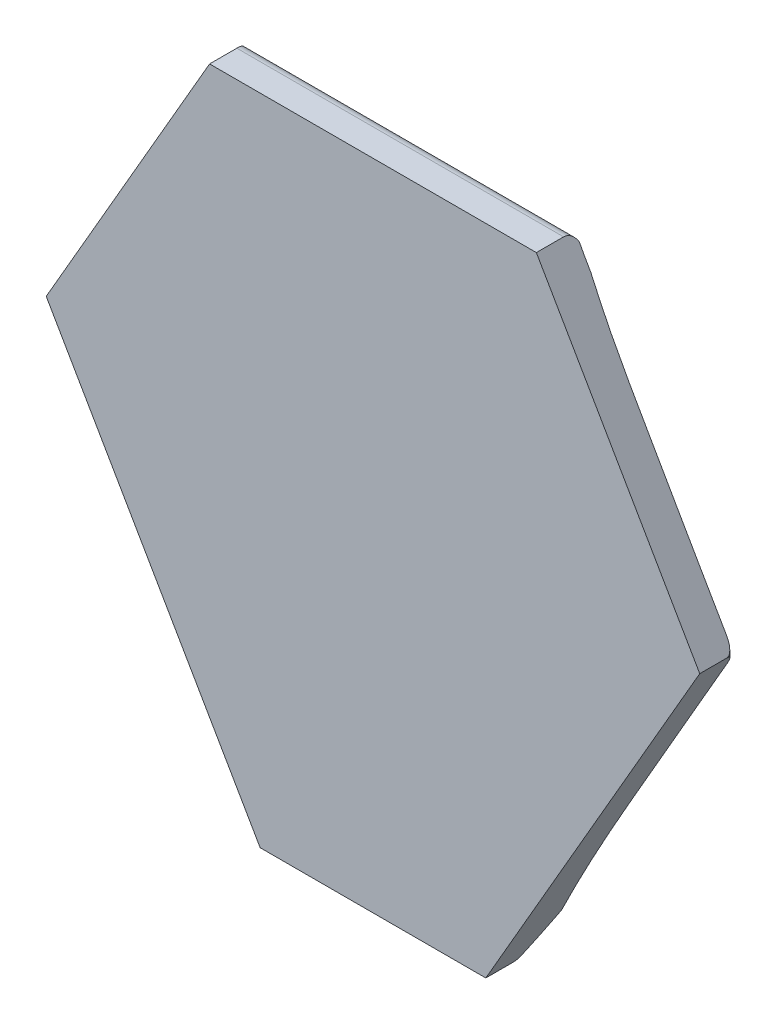
from build123d import *

# Parameters (mm, degrees)
BOSS_EXTRUDE1_DEPTH      = 101.6
BOSS_EXTRUDE1_DEPTH_BACK = 25.4
CUT_EXTRUDE5_DEPTH       = 690.084726286
CUT_EXTRUDE7_START       = -167.47195291
CUT_EXTRUDE7_DEPTH       = 334.94390582


with BuildPart() as part:
    # Sketch2 → Boss-Extrude1 (new, two sides: drawn at the far end of the back side and taken through both)
    with BuildSketch(Plane.XY.offset(-BOSS_EXTRUDE1_DEPTH_BACK)):
        Polygon((-152.4, 263.964543073), (152.4, 263.964543073), (304.8, 0), (105.247275902, -345.635456927), (-105.247275902, -345.635456927), (-304.8, 0), align=None)
    extrude(amount=BOSS_EXTRUDE1_DEPTH + BOSS_EXTRUDE1_DEPTH_BACK)

    # Sketch3 → Cut-Extrude5 (cut, through all)
    with BuildSketch(Plane(origin=(0, 263.964543073, 0), x_dir=(1, 0, 0), z_dir=(0, 1, 0))):
        with BuildLine():
            Line((-304.8, -76.2), (-304.8, 25.4))
            Line((-304.8, 25.4), (304.8, 25.4))
            Line((304.8, 25.4), (304.8, -76.2))
            ThreePointArc((304.8, -76.2), (302.940128061, -71.709871939), (298.45, -69.85))
            ThreePointArc((298.45, -69.85), (252.51979015, -69.714637969), (206.591176001, -69.30855658))
            ThreePointArc((206.591176001, -69.30855658), (119.939950937, -53.691572752), (43.155890442, -10.604068265))
            ThreePointArc((43.155890442, -10.604068265), (34.818219716, -4.738506069), (25.792249783, 0))
            ThreePointArc((25.792249783, 0), (0, 5.478791422), (-25.792249783, 0))
            ThreePointArc((-25.792249783, 0), (-34.818219716, -4.738506069), (-43.155890442, -10.604068265))
            ThreePointArc((-43.155890442, -10.604068265), (-119.939950937, -53.691572752), (-206.591176001, -69.30855658))
            ThreePointArc((-206.591176001, -69.30855658), (-252.51979015, -69.714637969), (-298.45, -69.85))
            ThreePointArc((-298.45, -69.85), (-302.940128061, -71.709871939), (-304.8, -76.2))
        make_face()
    extrude(amount=-CUT_EXTRUDE5_DEPTH, mode=Mode.SUBTRACT)

    # Cut-Extrude7: read off the stored shape, not the designer's step
    # Cut-Extrude7 outline → Cut-Extrude7 (cut)
    with BuildSketch(Plane(origin=(0, 0, 0), x_dir=(0, 0, -1), z_dir=(1, 0, 0)).offset(CUT_EXTRUDE7_START)):
        with BuildLine():
            ThreePointArc((-76.2, 263.964543073), (-69.788494044, 261.94466991), (-65.692525933, 256.614534691))
            add(Edge.make_bspline(
                [(-65.692525933, 256.614534691), (-71.486350731, 90.510366485), (-0.882192536, 198.749340281), (23.113391949, 17.574151868), (-16.69864439, -54.274132463), (-38.1, -256.513950378), (-69.85, -339.285456927)],
                knots=[0, 0, 0, 0, 0, 0, 0, 1, 1, 1, 1, 1, 1, 1], degree=6))
            ThreePointArc((-69.85, -339.285456927), (-71.709871939, -343.775584987), (-76.2, -345.635456927))
            Line((-76.2, -345.635456927), (7, -345.635456927))
            Line((7, -345.635456927), (7, 263.964543073))
            Line((7, 263.964543073), (-76.2, 263.964543073))
        make_face()
    extrude(amount=CUT_EXTRUDE7_DEPTH, mode=Mode.SUBTRACT)


solid = part.part
